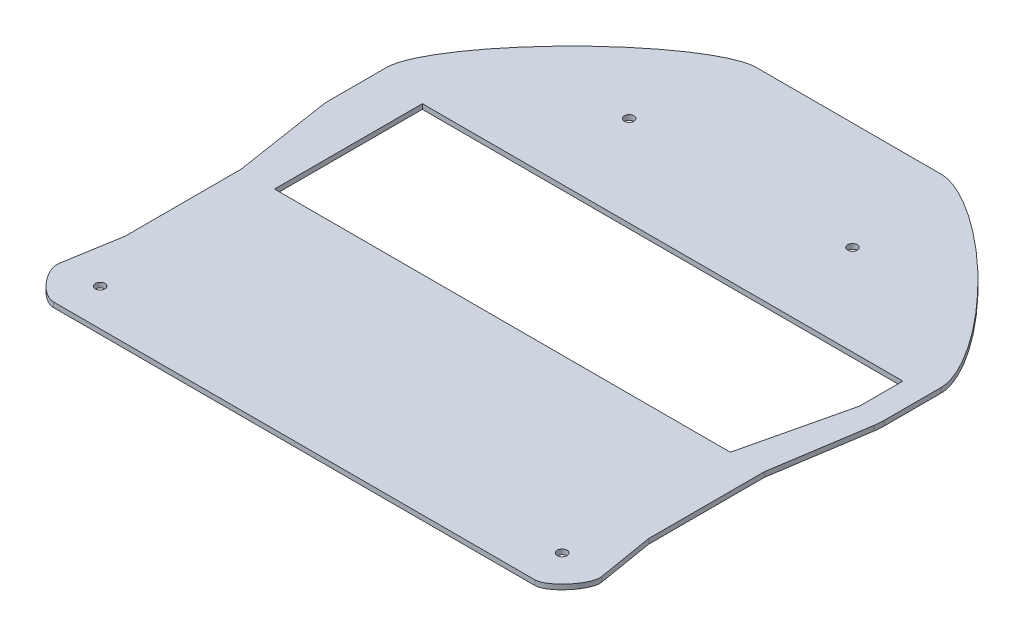
from build123d import *

# Parameters (mm, degrees)
SKETCH1_W           = 80
SKETCH1_H           = 30
SKETCH1_W_2         = 50
BOSS_EXTRUDE1_DEPTH = 1.6
FILLET1_SIZE        = 60
SKETCH6_W           = 80
SKETCH6_H           = 30
CUT_EXTRUDE1_DEPTH  = 10
FILLET3_R           = 20
CUT_EXTRUDE3_REACH  = 256.563
CUT_EXTRUDE5_REACH  = 256.563
SKETCH11_R          = 1.55


with BuildPart() as part:
    # Sketch1 → Boss-Extrude1 (new body)
    with BuildSketch(Plane(origin=(0, 0, 0), x_dir=(1, 0, 0), z_dir=(0, 1, 0))):
        with Locations((-90, -15)):
            Rectangle(SKETCH1_W, SKETCH1_H)
        Polygon((0, 180), (-180, 180), (-180, 30), (-130, 30), (-50, 30), (0, 30), align=None)
        with Locations((-25, 15)):
            Rectangle(SKETCH1_W_2, SKETCH1_H)
        with Locations((-155, 15)):
            Rectangle(SKETCH1_W_2, SKETCH1_H)
        with Locations((-90, 15)):
            Rectangle(SKETCH1_W, SKETCH1_H)
    extrude(amount=BOSS_EXTRUDE1_DEPTH)

    # Fillet1
    # a fillet whose section is not a circle: 60 mm, written as the material it takes off along each edge
    with BuildSketch(Plane(origin=(0, -150, -180), x_dir=(0, 0, 1), z_dir=(0, 1, 0)), Plane(origin=(-180, -150, -180), x_dir=(1, 0, 0), z_dir=(0, 1, 0))) as fillet1_piece_1:
        with BuildLine():
            Bezier((FILLET1_SIZE, 0), (0, 0), (0, -FILLET1_SIZE), weights=[1, 0.25, 1])
            Line((0, -FILLET1_SIZE), (0, 0))
            Line((0, 0), (FILLET1_SIZE, 0))
        make_face()
    extrude(amount=301.6, mode=Mode.SUBTRACT)

    # Sketch6 → Cut-Extrude1 (cut)
    with BuildSketch(Plane(origin=(0, 1.6, 0), x_dir=(1, 0, 0), z_dir=(0, 1, 0))):
        with Locations((-90, -15)):
            Rectangle(SKETCH6_W, SKETCH6_H)
        Polygon((-180, 100), (-180, 0), (-175, 30.1112758), (-175, 67.7112758), align=None)
        Polygon((-5, 30.1112758), (0, 0), (0, 100), (-5, 67.7112758), align=None)
    extrude(amount=-CUT_EXTRUDE1_DEPTH, mode=Mode.SUBTRACT)

    # Fillet2
    # a fillet whose section is not a circle: 10 mm, written as the material it takes off along each edge
    with BuildSketch(Plane(origin=(-180, -29.493585843, 0), x_dir=(1, 0, 0), z_dir=(0, 1, 0)), Plane(origin=(0, -29.493585843, 0), x_dir=(-0.16380778451733694, 0, -0.9864922755559323), z_dir=(0, 1, 0))) as fillet2_piece_1:
        with BuildLine():
            Bezier((11.797434337, 0), (0, 0), (1.932511582, 11.638077845), weights=[1, 0.333333333, 1])
            Line((1.932511582, 11.638077845), (0, 0))
            Line((0, 0), (11.797434337, 0))
        make_face()
    extrude(amount=60.587171687, mode=Mode.SUBTRACT)

    # Fillet3
    fillet3_edges = [part.edges().sort_by_distance(p)[0] for p in [
        (0, 0.8, -100),
        (-180, 0.8, -100),
    ]]
    fillet(fillet3_edges, radius=FILLET3_R)

    # Sketch9 → Cut-Extrude3 (cut, up to next)
    with BuildSketch(Plane(origin=(0, 1.6, 0), x_dir=(1, 0, 0), z_dir=(0, 1, 0)), mode=Mode.PRIVATE) as cut_extrude3_sk1:
        Polygon((-164, 115.6), (-164, 67.6), (-16, 67.6), (-8, 101.53935467), (-8, 115.6), align=None)
    cut_extrude3_tool1 = extrude(cut_extrude3_sk1.sketch, amount=-CUT_EXTRUDE3_REACH, mode=Mode.PRIVATE) & part.part
    add(cut_extrude3_tool1.solids().sort_by_distance((-87.391012, 1.6, -91.83426))[0], mode=Mode.SUBTRACT)

    # Sketch11 → Cut-Extrude5 (cut, up to next)
    with BuildSketch(Plane(origin=(0, 1.6, 0), x_dir=(1, 0, 0), z_dir=(0, 1, 0)), mode=Mode.PRIVATE) as cut_extrude5_sk1:
        with Locations(Location((-165, 12, 0), (0, 0, 270))):
            Circle(SKETCH11_R)
    cut_extrude5_tool1 = extrude(cut_extrude5_sk1.sketch, amount=-CUT_EXTRUDE5_REACH, mode=Mode.PRIVATE) & part.part
    # Sketch11 → Cut-Extrude5 (cut, up to next)
    with BuildSketch(Plane(origin=(0, 1.6, 0), x_dir=(1, 0, 0), z_dir=(0, 1, 0)), mode=Mode.PRIVATE) as cut_extrude5_sk2:
        with Locations(Location((-126.25, 145, 0), (0, 0, 270))):
            Circle(SKETCH11_R)
    cut_extrude5_tool2 = extrude(cut_extrude5_sk2.sketch, amount=-CUT_EXTRUDE5_REACH, mode=Mode.PRIVATE) & part.part
    # Sketch11 → Cut-Extrude5 (cut, up to next)
    with BuildSketch(Plane(origin=(0, 1.6, 0), x_dir=(1, 0, 0), z_dir=(0, 1, 0)), mode=Mode.PRIVATE) as cut_extrude5_sk3:
        with Locations(Location((-15, 12, 0), (0, 0, 270))):
            Circle(SKETCH11_R)
    cut_extrude5_tool3 = extrude(cut_extrude5_sk3.sketch, amount=-CUT_EXTRUDE5_REACH, mode=Mode.PRIVATE) & part.part
    # Sketch11 → Cut-Extrude5 (cut, up to next)
    with BuildSketch(Plane(origin=(0, 1.6, 0), x_dir=(1, 0, 0), z_dir=(0, 1, 0)), mode=Mode.PRIVATE) as cut_extrude5_sk4:
        with Locations(Location((-53.75, 145, 0), (0, 0, 270))):
            Circle(SKETCH11_R)
    cut_extrude5_tool4 = extrude(cut_extrude5_sk4.sketch, amount=-CUT_EXTRUDE5_REACH, mode=Mode.PRIVATE) & part.part
    add(cut_extrude5_tool1.solids().sort_by_distance((-165, 1.6, -12))[0], mode=Mode.SUBTRACT)
    add(cut_extrude5_tool2.solids().sort_by_distance((-126.25, 1.6, -145))[0], mode=Mode.SUBTRACT)
    add(cut_extrude5_tool3.solids().sort_by_distance((-15, 1.6, -12))[0], mode=Mode.SUBTRACT)
    add(cut_extrude5_tool4.solids().sort_by_distance((-53.75, 1.6, -145))[0], mode=Mode.SUBTRACT)


solid = part.part
